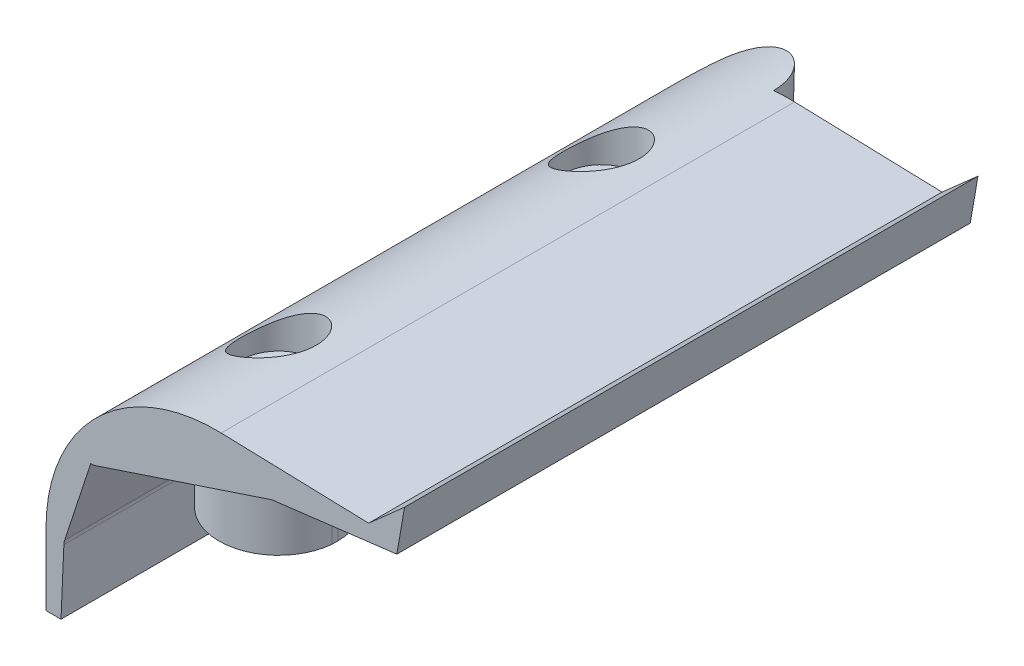
from build123d import *

# Parameters (mm, degrees)
BOSS_EXTRUDE1_DEPTH      = 33.7
FILLET1_R                = 20
FILLET2_R                = 10
CUT_EXTRUDE1_REACH       = 42.524
CUT_EXTRUDE1_END_RADIUS  = 20
SKETCH18_W               = 10.7
SKETCH18_H               = 4.190618397
CUT_EXTRUDE2_REACH       = 38.996
CUT_EXTRUDE3_REACH       = 38.996
CUT_EXTRUDE4_REACH       = 41.13
CUT_EXTRUDE5_REACH       = 41.13
CUT_EXTRUDE6_REACH       = 41.13
SKETCH37_W               = 7.010527041
SKETCH37_H               = 4.046754886
CUT_EXTRUDE7_DEPTH       = 30.450302171
CUT_EXTRUDE8_DEPTH       = 10
SKETCH40_R               = 1.25
CUT_EXTRUDE9_DEPTH       = 37.995504756
SKETCH41_R               = 2.75
CUT_EXTRUDE10_DEPTH      = 5
SKETCH42_R               = 2.208277428
CUT_EXTRUDE11_DEPTH      = 3
CUT_EXTRUDE12_DEPTH      = 37.18178953
FILLET3_R                = 1
BOSS_EXTRUDE2_REACH      = 40.099
SKETCH44_R               = 2.980312175
CUT_EXTRUDE13_REACH      = 40.099
CUT_EXTRUDE13_END_RADIUS = 10
SKETCH46_R               = 2.980312175
CUT_EXTRUDE14_REACH      = 40.026


with BuildPart() as part:
    # Sketch17 → Boss-Extrude1 (new body)
    with BuildSketch(Plane.XY):
        Polygon((10.53663492, 7.900076539), (10.081415975, 5.280038612), (2.74336508, 4.379039255), (-0.749806064, 3.218028635), (-0.749806064, -3.143324057), (-7.713813222, -3.143324057), (-8.111536279, 0.095870306), (-9.33663492, -4.700076539), (-9.33663492, -7.900076539), (-10.53663492, -7.900076539), (-10.53663492, -3.500076539), (-10.53663492, 6.590057575), (8.423934133, 6.030416141), align=None)
    extrude(amount=BOSS_EXTRUDE1_DEPTH)

    # Fillet1
    fillet1_edges = [part.edges().sort_by_distance(p)[0] for p in [
        (-9.33663492, -4.700076539, 16.85),
    ]]
    fillet(fillet1_edges, radius=FILLET1_R)

    # Fillet2
    fillet2_edges = [part.edges().sort_by_distance(p)[0] for p in [
        (-10.53663492, 6.590057575, 16.85),
    ]]
    fillet(fillet2_edges, radius=FILLET2_R)

    # Cut-Extrude1: up to this cylinder (the profile starts outside it)
    cut_extrude1_end = Plane(origin=(10.66336508, -7.214158247, 16.8), z_dir=(0, 0, 1)) * Cylinder(CUT_EXTRUDE1_END_RADIUS, 126.048, mode=Mode.PRIVATE)
    # Sketch18 → Cut-Extrude1 (cut, up to the surface)
    with BuildSketch(Plane.ZY.offset(10.53663492), mode=Mode.PRIVATE) as cut_extrude1_sk1:
        with Locations((16.8, -5.804767341)):
            Rectangle(SKETCH18_W, SKETCH18_H)
    cut_extrude1_tool1 = extrude(cut_extrude1_sk1.sketch, amount=-CUT_EXTRUDE1_REACH, mode=Mode.PRIVATE) - cut_extrude1_end
    add(cut_extrude1_tool1.solids().sort_by_distance((-10.536635, -5.804767, 16.8))[0], mode=Mode.SUBTRACT)

    # Cut-Extrude2: up to this plane
    cut_extrude2_end = Plane(origin=(2.74336508, 4.379039255, 33.7), z_dir=(-0.3154013115740007, 0.9489583829954822, 0))
    # Sketch32 → Cut-Extrude2 (cut, up to the surface)
    with BuildSketch(Plane.XZ.offset(3.143324057), mode=Mode.PRIVATE) as cut_extrude2_sk1:
        with BuildLine():
            Line((-0.749806064, 33.7), (-7.713813222, 33.7))
            Line((-7.713813222, 33.7), (-7.713813222, 26.689472959))
            ThreePointArc((-7.713813222, 26.689472959), (-4.231809642, 29.835), (-0.749806064, 26.689472956))
            Line((-0.749806064, 26.689472956), (-0.749806064, 33.7))
        make_face()
    cut_extrude2_tool1 = split(extrude(cut_extrude2_sk1.sketch, amount=-CUT_EXTRUDE2_REACH, mode=Mode.PRIVATE), bisect_by=cut_extrude2_end, keep=Keep.BOTH, mode=Mode.PRIVATE)
    add(cut_extrude2_tool1.solids().sort_by_distance((-4.23181, -3.143324, 31.335376))[0], mode=Mode.SUBTRACT)
    # Sketch32 → Cut-Extrude2 (cut, up to the surface)
    with BuildSketch(Plane.XZ.offset(3.143324057), mode=Mode.PRIVATE) as cut_extrude2_sk2:
        with BuildLine():
            ThreePointArc((-0.749806064, 7.010527044), (-4.231809642, 3.865), (-7.713813222, 7.010527041))
            Line((-7.713813222, 7.010527041), (-7.713813222, 0))
            Line((-7.713813222, 0), (-0.749806064, 0))
            Line((-0.749806064, 0), (-0.749806064, 7.010527044))
        make_face()
    cut_extrude2_tool2 = split(extrude(cut_extrude2_sk2.sketch, amount=-CUT_EXTRUDE2_REACH, mode=Mode.PRIVATE), bisect_by=cut_extrude2_end, keep=Keep.BOTH, mode=Mode.PRIVATE)
    add(cut_extrude2_tool2.solids().sort_by_distance((-4.23181, -3.143324, 2.364624))[0], mode=Mode.SUBTRACT)

    # Cut-Extrude3: up to this plane
    cut_extrude3_end = Plane(origin=(2.74336508, 4.379039255, 33.7), z_dir=(-0.3154013115740007, 0.9489583829954822, 0))
    # Sketch33 → Cut-Extrude3 (cut, up to the surface)
    with BuildSketch(Plane.XZ.offset(3.143324057), mode=Mode.PRIVATE) as cut_extrude3_sk1:
        with BuildLine():
            Line((-0.749806064, 26.335), (-0.749806064, 7.365))
            ThreePointArc((-0.749806064, 7.365), (-1.636617826, 9.6864927), (-3.845338986, 10.825489756))
            Line((-3.845338986, 10.825489756), (-3.845338986, 22.874510244))
            ThreePointArc((-3.845338986, 22.874510244), (-1.636617826, 24.0135073), (-0.749806064, 26.335))
        make_face()
    cut_extrude3_tool1 = split(extrude(cut_extrude3_sk1.sketch, amount=-CUT_EXTRUDE3_REACH, mode=Mode.PRIVATE), bisect_by=cut_extrude3_end, keep=Keep.BOTH, mode=Mode.PRIVATE)
    add(cut_extrude3_tool1.solids().sort_by_distance((-2.202773, -3.143324, 16.85))[0], mode=Mode.SUBTRACT)
    # Sketch33 → Cut-Extrude3 (cut, up to the surface)
    with BuildSketch(Plane.XZ.offset(3.143324057), mode=Mode.PRIVATE) as cut_extrude3_sk2:
        with BuildLine():
            Line((-7.713813222, 26.335), (-7.713813222, 7.365))
            ThreePointArc((-7.713813222, 7.365), (-6.966499846, 9.520416066), (-5.045338986, 10.750634199))
            Line((-5.045338986, 10.750634199), (-5.045338986, 22.916214753))
            Line((-5.045338986, 22.916214753), (-5.045338986, 22.949365801))
            ThreePointArc((-5.045338986, 22.949365801), (-6.966499846, 24.179583934), (-7.713813222, 26.335))
        make_face()
    cut_extrude3_tool2 = split(extrude(cut_extrude3_sk2.sketch, amount=-CUT_EXTRUDE3_REACH, mode=Mode.PRIVATE), bisect_by=cut_extrude3_end, keep=Keep.BOTH, mode=Mode.PRIVATE)
    add(cut_extrude3_tool2.solids().sort_by_distance((-6.459589, -3.143324, 16.85))[0], mode=Mode.SUBTRACT)

    # Cut-Extrude4: up to this plane
    cut_extrude4_end = Plane(origin=(-8.111536279, 0.095870306, 33.7), z_dir=(-0.9688885735577917, 0.2474973374182996, 0))
    # Sketch35 → Cut-Extrude4 (cut, up to the surface)
    with BuildSketch(Plane(origin=(-7.713813222, 0, 0), x_dir=(0, 0, -1), z_dir=(1, 0, 0)), mode=Mode.PRIVATE) as cut_extrude4_sk1:
        Polygon((-33.7, 0.903430829), (-26.689472959, 0.903430829), (-26.51223648, -3.143324057), (-33.7, -3.143324057), align=None)
    cut_extrude4_tool1 = split(extrude(cut_extrude4_sk1.sketch, amount=-CUT_EXTRUDE4_REACH, mode=Mode.PRIVATE), bisect_by=cut_extrude4_end, keep=Keep.BOTH, mode=Mode.PRIVATE)
    add(cut_extrude4_tool1.solids().sort_by_distance((-7.713813, -1.128366, 30.150243))[0], mode=Mode.SUBTRACT)

    # Cut-Extrude5: up to this plane
    cut_extrude5_end = Plane(origin=(-8.111536279, 0.095870306, 33.7), z_dir=(-0.9688885735577917, 0.2474973374182996, 0))
    # Sketch36 → Cut-Extrude5 (cut, up to the surface)
    with BuildSketch(Plane(origin=(-7.713813222, 0, 0), x_dir=(0, 0, -1), z_dir=(1, 0, 0)), mode=Mode.PRIVATE) as cut_extrude5_sk1:
        Polygon((-7.385460395, -3.179256499), (-26.335, -3.143324057), (-26.335, 0.903430829), (-7.365, 0.903430829), align=None)
    cut_extrude5_tool1 = split(extrude(cut_extrude5_sk1.sketch, amount=-CUT_EXTRUDE5_REACH, mode=Mode.PRIVATE), bisect_by=cut_extrude5_end, keep=Keep.BOTH, mode=Mode.PRIVATE)
    add(cut_extrude5_tool1.solids().sort_by_distance((-7.713813, -1.128579, 16.84114))[0], mode=Mode.SUBTRACT)

    # Cut-Extrude6: up to this plane
    cut_extrude6_end = Plane(origin=(-8.111536279, 0.095870306, 33.7), z_dir=(-0.9688885735577917, 0.2474973374182996, 0))
    # Sketch37 → Cut-Extrude6 (cut, up to the surface)
    with BuildSketch(Plane(origin=(-7.713813222, 0, 0), x_dir=(0, 0, -1), z_dir=(1, 0, 0)), mode=Mode.PRIVATE) as cut_extrude6_sk1:
        with Locations((-3.505263521, -1.119946614)):
            Rectangle(SKETCH37_W, SKETCH37_H)
    cut_extrude6_tool1 = split(extrude(cut_extrude6_sk1.sketch, amount=-CUT_EXTRUDE6_REACH, mode=Mode.PRIVATE), bisect_by=cut_extrude6_end, keep=Keep.BOTH, mode=Mode.PRIVATE)
    add(cut_extrude6_tool1.solids().sort_by_distance((-7.713813, -1.119947, 3.505264))[0], mode=Mode.SUBTRACT)

    # Sketch38 → Cut-Extrude7 (cut, through all)
    with BuildSketch(Plane(origin=(0, 0.036931473, 7.369342463), x_dir=(1, 0, 0), z_dir=(0, 0.005011438902896351, 0.999987442661218))):
        Polygon((-7.713813222, 0.866510236), (-7.905249318, 0.866510236), (-8.111536279, 0.058939572), (-7.713813222, -3.180295466), align=None)
    extrude(amount=-CUT_EXTRUDE7_DEPTH, mode=Mode.SUBTRACT)

    # Sketch39 → Cut-Extrude8 (cut)
    with BuildSketch(Plane(origin=(0, 0, 26.335), x_dir=(-1, 0, 0), z_dir=(0, 0, -1))):
        Polygon((7.905249318, 0.903430829), (7.713813222, 0.903430829), (7.713813222, -3.143324057), (8.111536279, 0.095870306), align=None)
    extrude(amount=-CUT_EXTRUDE8_DEPTH, mode=Mode.SUBTRACT)

    # Sketch40 → Cut-Extrude9 (cut, through all)
    with BuildSketch(Plane.XZ.offset(3.143324057)):
        with Locations((-4.231809643, 7.365)):
            Circle(SKETCH40_R)
        with Locations((-4.231809643, 26.335)):
            Circle(SKETCH40_R)
    extrude(amount=-CUT_EXTRUDE9_DEPTH, mode=Mode.SUBTRACT)

    # Sketch41 → Cut-Extrude10 (cut)
    with BuildSketch(Plane.XZ.offset(3.143324057)):
        with Locations((-4.231809643, 26.335)):
            Circle(SKETCH41_R)
        with Locations((-4.231809643, 7.365)):
            Circle(SKETCH41_R)
    extrude(amount=-CUT_EXTRUDE10_DEPTH, mode=Mode.SUBTRACT)

    # Sketch42 → Cut-Extrude11 (cut)
    with BuildSketch(Plane.ZX.offset(6.217374095)):
        with Locations((7.365, -4.231809643)):
            Circle(SKETCH42_R)
        with Locations((26.335, -4.231809643)):
            Circle(SKETCH42_R)
    extrude(amount=-CUT_EXTRUDE11_DEPTH, mode=Mode.SUBTRACT)

    # Sketch43 → Cut-Extrude12 (cut, through all)
    with BuildSketch(Plane.XY.offset(33.7)):
        Polygon((-7.905249318, 0.903430829), (-8.822914385, -1.887149193), (-9.480427728, -3.886619005), (-9.654860317, -7.900076539), (-8.364081852, -7.900076539), align=None)
    extrude(amount=-CUT_EXTRUDE12_DEPTH, mode=Mode.SUBTRACT)

    # Fillet3
    fillet3_edges = [part.edges().sort_by_distance(p)[0] for p in [
        (-9.480427728, -3.886619005, 5.725),
        (-9.480427728, -3.886619005, 27.925),
    ]]
    fillet(fillet3_edges, radius=FILLET3_R)

    # Boss-Extrude2: up to this plane
    boss_extrude2_end = Plane(origin=(2.74336508, 4.379039255, 33.7), z_dir=(-0.3154013115740007, 0.9489583829954822, 0))
    # Sketch44 → Boss-Extrude2 (add, up to the surface)
    with BuildSketch(Plane(origin=(0.185171765, 6.273592006, 0), x_dir=(0.999564685295442, -0.029503218641770287, 0), z_dir=(0.029503218641770287, 0.999564685295442, 0)), mode=Mode.PRIVATE) as boss_extrude2_sk1:
        with Locations((-4.641678191, 0)):
            Circle(SKETCH44_R)
    boss_extrude2_tool1 = split(extrude(boss_extrude2_sk1.sketch, amount=-BOSS_EXTRUDE2_REACH, mode=Mode.PRIVATE), bisect_by=boss_extrude2_end, keep=Keep.BOTH, mode=Mode.PRIVATE)
    add(boss_extrude2_tool1.solids().sort_by_distance((-4.454486, 6.410536, 0))[0])

    # Cut-Extrude13: up to this cylinder (the profile starts outside it)
    cut_extrude13_end = Plane(origin=(-0.53663492, -3.709458142, 0), z_dir=(0, 0, -1)) * Cylinder(CUT_EXTRUDE13_END_RADIUS, 101.198, mode=Mode.PRIVATE)
    # Sketch46 → Cut-Extrude13 (cut, up to the surface)
    with BuildSketch(Plane(origin=(0.185171765, 6.273592006, 0), x_dir=(0.999564685295442, -0.029503218641770287, 0), z_dir=(0.029503218641770287, 0.999564685295442, 0)), mode=Mode.PRIVATE) as cut_extrude13_sk1:
        with Locations((-4.641678191, 0)):
            Circle(SKETCH46_R)
    cut_extrude13_tool1 = extrude(cut_extrude13_sk1.sketch, amount=-CUT_EXTRUDE13_REACH, mode=Mode.PRIVATE) - cut_extrude13_end
    add(cut_extrude13_tool1.solids().sort_by_distance((-4.454486, 6.410536, 0))[0], mode=Mode.SUBTRACT)

    # Cut-Extrude14: up to this plane
    cut_extrude14_end = Plane(origin=(2.74336508, 4.379039255, 33.7), z_dir=(-0.3154013115740007, 0.9489583829954822, 0))
    # Sketch47 → Cut-Extrude14 (cut, up to the surface)
    with BuildSketch(Plane.ZX.offset(6.217374095), mode=Mode.PRIVATE) as cut_extrude14_sk1:
        with BuildLine():
            Line((-2.274089727, -6.442110298), (-1.428952647, -8.002768724))
            Line((-1.428952647, -8.002768724), (0, -7.523636117))
            add(Edge.make_bspline(
                [(0, -7.523636117), (-1.334083286, -7.279775766), (-2.274089727, -6.442110298)],
                knots=[0, 0, 0, 1, 1, 1], degree=2))
        make_face()
    cut_extrude14_tool1 = split(extrude(cut_extrude14_sk1.sketch, amount=-CUT_EXTRUDE14_REACH, mode=Mode.PRIVATE), bisect_by=cut_extrude14_end, keep=Keep.BOTH, mode=Mode.PRIVATE)
    add(cut_extrude14_tool1.solids().sort_by_distance((-7.404175, 6.217374, -1.25113))[0], mode=Mode.SUBTRACT)


solid = part.part
